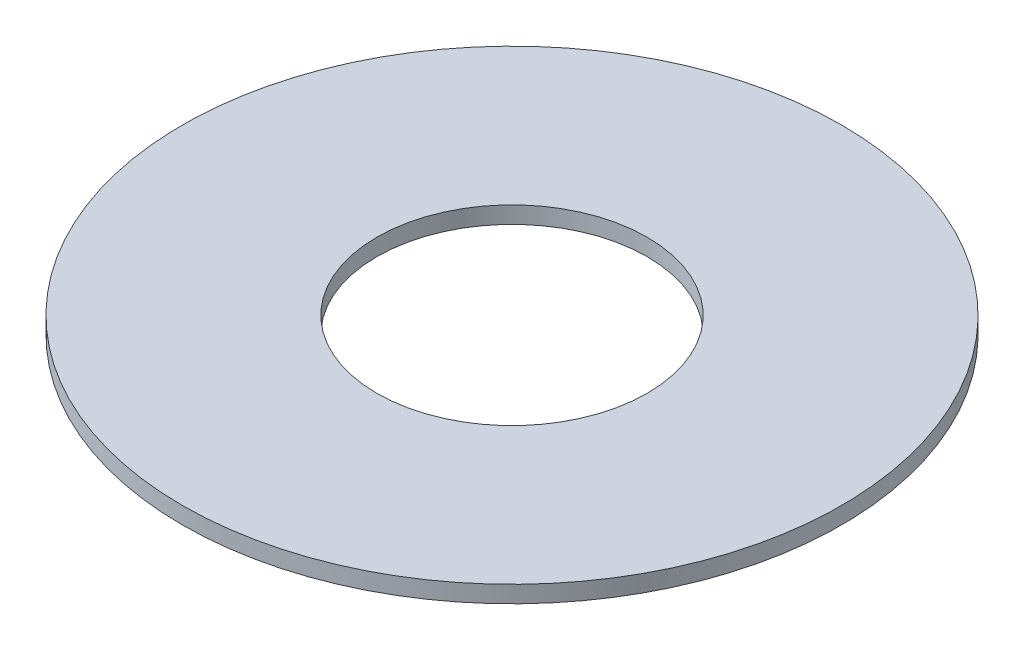
from build123d import *

# Parameters (mm, degrees)
SKETCH1_R           = 97.5
BOSS_EXTRUDE1_DEPTH = 5
SKETCH2_R           = 40
CUT_EXTRUDE1_DEPTH  = 138.976447265


with BuildPart() as part:
    # Sketch1 → Boss-Extrude1 (new body)
    with BuildSketch(Plane(origin=(0, 0, 0), x_dir=(1, 0, 0), z_dir=(0, 1, 0))):
        Circle(SKETCH1_R)
    extrude(amount=BOSS_EXTRUDE1_DEPTH)

    # Sketch2 → Cut-Extrude1 (cut, through all)
    with BuildSketch(Plane(origin=(0, 0, 0), x_dir=(1, 0, 0), z_dir=(0, 1, 0))):
        Circle(SKETCH2_R)
    extrude(amount=CUT_EXTRUDE1_DEPTH, mode=Mode.SUBTRACT)


solid = part.part
